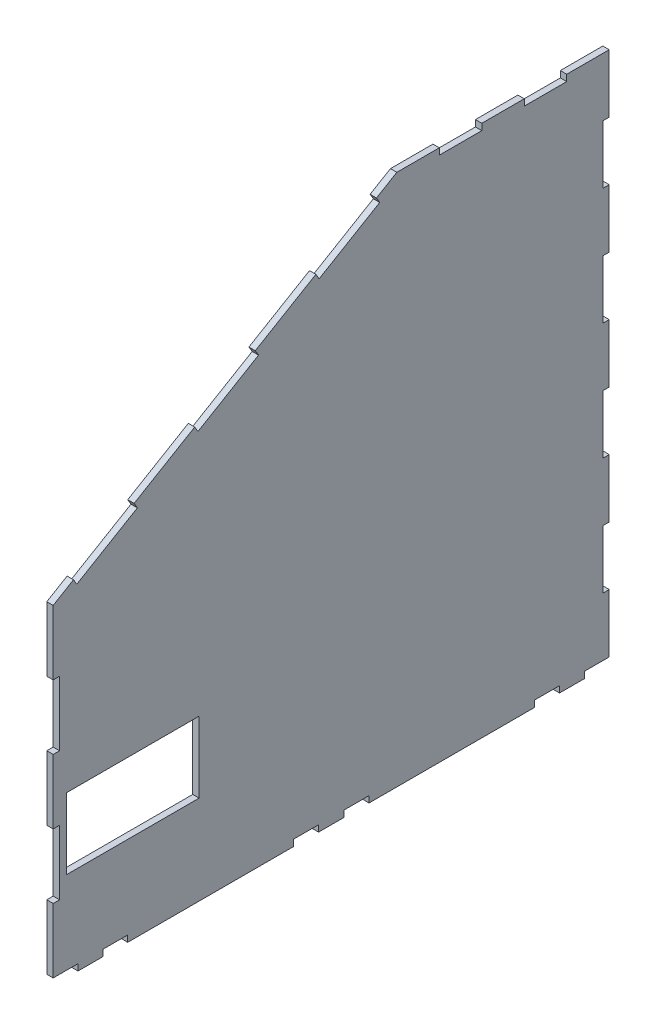
from build123d import *

# Parameters (mm, degrees)
SKETCH1_W           = 56
SKETCH1_H           = 30
BOSS_EXTRUDE1_DEPTH = 2.7


with BuildPart() as part:
    # Sketch1 → Boss-Extrude1 (new body)
    with BuildSketch(Plane(origin=(0, 0, 0), x_dir=(0, 0, -1), z_dir=(1, 0, 0))):
        Polygon((117.52, 87.8), (117.52, 112.5), (99.566, 112.5), (99.566, 109.8), (81.612, 109.8), (81.612, 112.5), (63.658, 112.5), (63.658, 109.8), (45.704, 109.8), (45.704, 112.5), (27.75, 112.5), (19.142256818, 107.410131897), (20.516521206, 105.086041238), (-5.094381521, 89.941988479), (-6.468645909, 92.266079138), (-32.079548636, 77.122026379), (-30.705284249, 74.79793572), (-56.316186976, 59.653882961), (-57.690451364, 61.977973621), (-83.301354091, 46.833920862), (-81.927089703, 44.509830203), (-107.53799243, 29.365777444), (-108.912256818, 31.689868103), (-117.52, 26.6), (-117.52, -0.68), (-114.82, -0.68), (-114.82, -27.96), (-117.52, -27.96), (-117.52, -55.24), (-114.82, -55.24), (-114.82, -82.52), (-117.52, -82.52), (-117.52, -109.8), (-107.013333333, -109.8), (-107.013333333, -112.5), (-96.506666667, -112.5), (-96.506666667, -109.8), (-86, -109.8), (-86, -112.5), (-16, -112.5), (-16, -109.8), (-5.333333333, -109.8), (-5.333333333, -112.5), (5.333333333, -112.5), (5.333333333, -109.8), (16, -109.8), (16, -112.5), (86, -112.5), (86, -109.8), (96.506666667, -109.8), (96.506666667, -112.5), (107.013333333, -112.5), (107.013333333, -109.8), (117.52, -109.8), (117.52, -85.1), (114.82, -85.1), (114.82, -60.4), (117.52, -60.4), (117.52, -35.7), (114.82, -35.7), (114.82, -11), (117.52, -11), (117.52, 13.7), (114.82, 13.7), (114.82, 38.4), (117.52, 38.4), (117.52, 63.1), (114.82, 63.1), (114.82, 87.8), align=None)
        with Locations((-83.82, -59.8)):
            Rectangle(SKETCH1_W, SKETCH1_H, mode=Mode.SUBTRACT)
    extrude(amount=BOSS_EXTRUDE1_DEPTH)


solid = part.part
